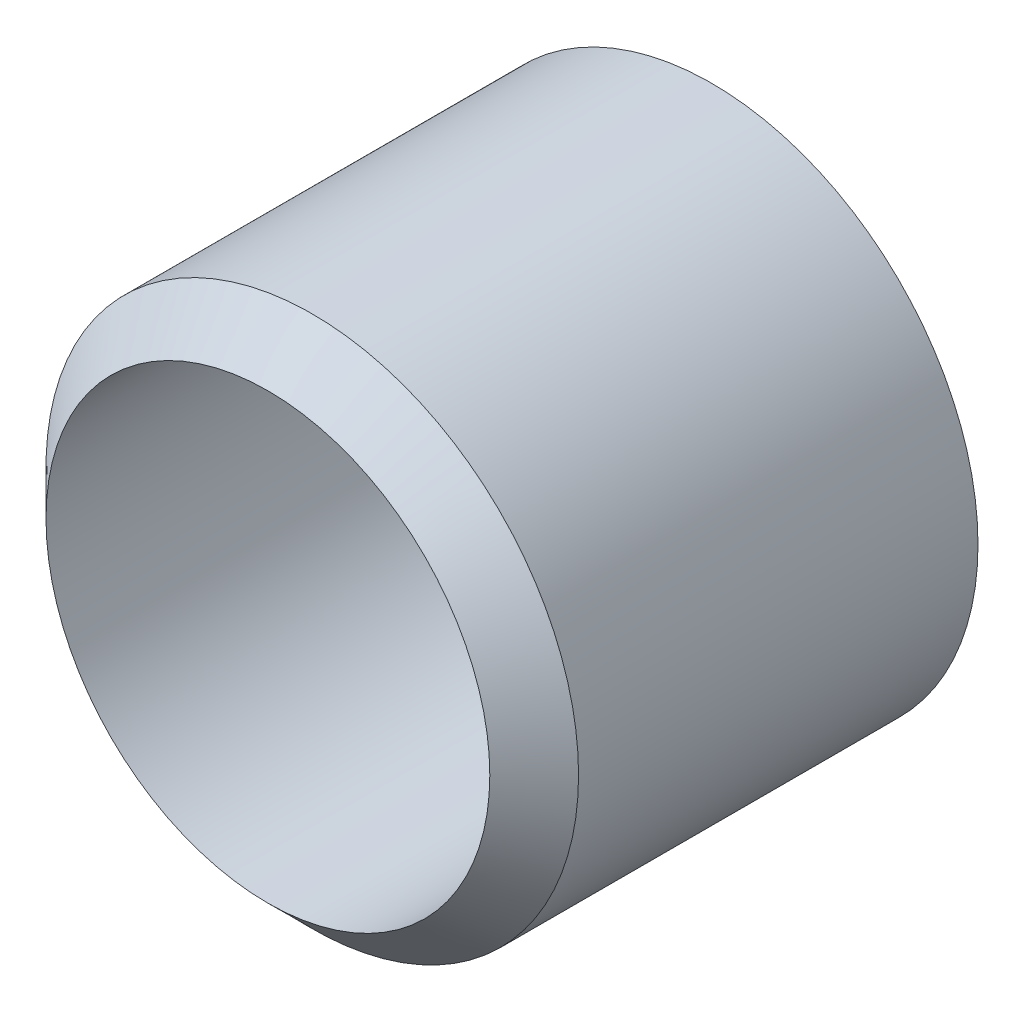
from build123d import *

# Parameters (mm, degrees)
SKETCH2_R           = 300
SKETCH2_R_2         = 250
BOSS_EXTRUDE1_DEPTH = 500
CHAMFER1_SIZE       = 50


with BuildPart() as part:
    # Sketch2 → Boss-Extrude1 (new body)
    with BuildSketch(Plane.XY):
        Circle(SKETCH2_R)
        Circle(SKETCH2_R_2, mode=Mode.SUBTRACT)
    extrude(amount=BOSS_EXTRUDE1_DEPTH)

    # Chamfer1
    chamfer1_edges = [part.edges().sort_by_distance(p)[0] for p in [
        (-300, 0, 500),
    ]]
    chamfer(chamfer1_edges, length=CHAMFER1_SIZE - 0.0001)  # a hair under: the kernel refuses the full size


solid = part.part
